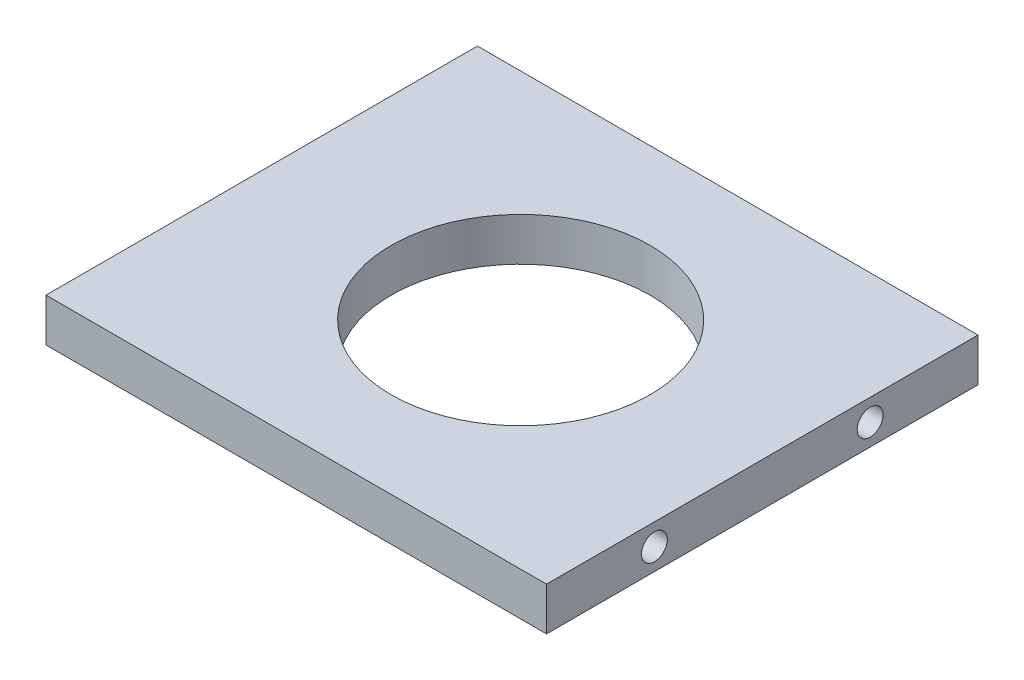
from build123d import *

# Parameters (mm, degrees)
ESQUISSE1_W             = 58
ESQUISSE1_H             = 5
BOSS_EXTRU_1_DEPTH      = 50
ESQUISSE2_R             = 15
ENL_V_MAT_EXTRU_1_DEPTH = 73.672209269
ESQUISSE3_R             = 1.5
ENL_V_MAT_EXTRU_2_DEPTH = 10
ENL_V_START             = -10
ESQUISSE4_R             = 1.5
ENL_V_MAT_EXTRU_3_DEPTH = 10


with BuildPart() as part:
    # Esquisse1 → Boss.-Extru.1 (new body)
    with BuildSketch(Plane.XY):
        with Locations((23.5, -47.5)):
            Rectangle(ESQUISSE1_W, ESQUISSE1_H)
    extrude(amount=BOSS_EXTRU_1_DEPTH)

    # Esquisse2 → Enlèv. mat.-Extru.1 (cut, through all)
    with BuildSketch(Plane(origin=(0, -45, 0), x_dir=(-1, 0, 0), z_dir=(0, 1, 0))):
        with Locations((-24.5, 25)):
            Circle(ESQUISSE2_R)
    extrude(amount=-ENL_V_MAT_EXTRU_1_DEPTH, mode=Mode.SUBTRACT)

    # Esquisse3 → Enlèv. mat.-Extru.2 (cut)
    with BuildSketch(Plane.ZY.offset(5.5)):
        with Locations((12.5, -47.5)):
            Circle(ESQUISSE3_R)
        with Locations((37.5, -47.5)):
            Circle(ESQUISSE3_R)
    extrude(amount=-ENL_V_MAT_EXTRU_2_DEPTH, mode=Mode.SUBTRACT)

    # Esquisse4 → Enlèv. mat.-Extru.3 (cut)
    with BuildSketch(Plane(origin=(52.5, 0, 0), x_dir=(0, 0, -1), z_dir=(1, 0, 0)).offset(ENL_V_START)):
        with Locations((-37.5, -47.5)):
            Circle(ESQUISSE4_R)
        with Locations((-12.5, -47.5)):
            Circle(ESQUISSE4_R)
    extrude(amount=ENL_V_MAT_EXTRU_3_DEPTH, mode=Mode.SUBTRACT)


solid = part.part
